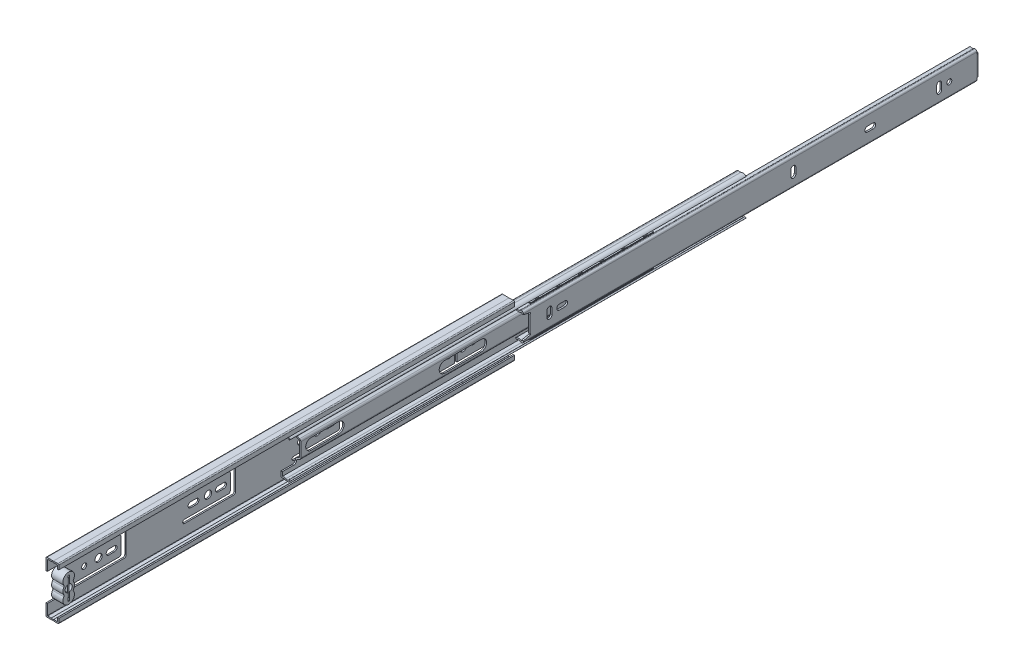
from build123d import *

# Parameters (mm, degrees)
BOSS_EXTRUDE1_START      = 6.35
BOSS_EXTRUDE1_DEPTH      = 400.05
BOSS_EXTRUDE2_DEPTH      = 203.2
BOSS_EXTRUDE2_DEPTH_BACK = 196.85
BOSS_EXTRUDE3_DEPTH      = 400.05
SKETCH8_W                = 1.905
SKETCH8_H                = 3.25755
CUT_EXTRUDE1_DEPTH       = 408.238333333
SKETCH9_W                = 1.397
SKETCH9_H                = 17.78
BOSS_EXTRUDE4_DEPTH      = 5.36016
FILLET1_R                = 1.651
FILLET2_R                = 0.254
SKETCH10_R               = 2.286
SKETCH10_R_2             = 3.175
CUT_EXTRUDE3_DEPTH       = 408.238333333
CUT_EXTRUDE5_DEPTH       = 408.114735613
CUT_EXTRUDE6_DEPTH       = 408.238333333
CUT_EXTRUDE6_DEPTH_BACK  = 408.238333333
SKETCH12_R               = 2.1844
SKETCH13_W               = 1.1938
SKETCH13_H               = 14.986
BOSS_EXTRUDE5_DEPTH      = 9.398
FILLET3_R                = 1.524
FILLET4_R                = 0.254
BOSS_EXTRUDE6_DEPTH      = 9.906
FILLET5_R                = 1.524
BOSS_EXTRUDE7_DEPTH      = 0.381
BOSS_EXTRUDE7_DEPTH_BACK = 0.381
SKETCH15_W               = 7.62
SKETCH15_H               = 107.95
LPATTERN1_COUNT          = 6
LPATTERN1_PITCH          = 19.05
BOSS_EXTRUDE8_DEPTH      = 0.381
BOSS_EXTRUDE8_DEPTH_BACK = 0.381
SKETCH17_W               = 5.08
SKETCH17_H               = 107.95
LPATTERN2_COUNT          = 6
LPATTERN2_PITCH          = 19.05


with BuildPart() as part:
    # Sketch5 → Boss-Extrude1 (new body)
    with BuildSketch(Plane.XY.offset(BOSS_EXTRUDE1_START)):
        with BuildLine():
            Line((4.9276, 18.415), (3.7338, 18.415))
            Line((3.7338, 18.415), (3.7338, 21.351668876))
            ThreePointArc((3.7338, 21.351668876), (3.656156384, 21.534465008), (3.470694285, 21.605505607))
            Line((3.470694285, 21.605505607), (0.424077102, 21.496216345))
            ThreePointArc((0.424077102, 21.496216345), (-0.671736167, 21.758871638), (-1.775065006, 21.529830168))
            Line((-1.775065006, 21.529830168), (-4.895551055, 21.611542971))
            ThreePointArc((-4.895551055, 21.611542971), (-5.079438777, 21.539570704), (-5.1562, 21.357630011))
            Line((-5.1562, 21.357630011), (-5.1562, -21.357630011))
            ThreePointArc((-5.1562, -21.357630011), (-5.079438777, -21.539570704), (-4.895551055, -21.611542971))
            Line((-4.895551055, -21.611542971), (-1.775065006, -21.529830168))
            ThreePointArc((-1.775065006, -21.529830168), (-0.671736167, -21.758871638), (0.424077102, -21.496216345))
            Line((0.424077102, -21.496216345), (3.470694285, -21.605505607))
            ThreePointArc((3.470694285, -21.605505607), (3.656156384, -21.534465008), (3.7338, -21.351668876))
            Line((3.7338, -21.351668876), (3.7338, -18.415))
            Line((3.7338, -18.415), (4.9276, -18.415))
            Line((4.9276, -18.415), (4.9276, -21.970365))
            ThreePointArc((4.9276, -21.970365), (4.667493886, -22.582732042), (4.046195853, -22.820718048))
            Line((4.046195853, -22.820718048), (0.032004, -22.676719627))
            Line((0.032004, -22.676719627), (-5.476826035, -22.820973418))
            ThreePointArc((-5.476826035, -22.820973418), (-6.092849902, -22.579866324), (-6.35, -21.970365))
            Line((-6.35, -21.970365), (-6.35, 21.970365))
            ThreePointArc((-6.35, 21.970365), (-6.092849902, 22.579866324), (-5.476826035, 22.820973418))
            Line((-5.476826035, 22.820973418), (0.032004, 22.676719627))
            Line((0.032004, 22.676719627), (4.046195853, 22.820718048))
            ThreePointArc((4.046195853, 22.820718048), (4.667493886, 22.582732042), (4.9276, 21.970365))
            Line((4.9276, 21.970365), (4.9276, 18.415))
        make_face()
    extrude(amount=BOSS_EXTRUDE1_DEPTH)

    # Sketch10 → Cut-Extrude3 (cut, through all)
    with BuildSketch(Plane(origin=(6.35, 0, 0), x_dir=(0, 0, -1), z_dir=(1, 0, 0))):
        with Locations(Location((-374.0912, 0, 0), (0, 0, 90))):
            Circle(SKETCH10_R)
        with Locations(Location((-53.9496, 0, 0), (0, 0, 90))):
            Circle(SKETCH10_R)
        with Locations(Location((-32.3596, 0, 0), (0, 0, 90))):
            Circle(SKETCH10_R)
        with Locations(Location((-41.3512, 0, 0), (0, 0, 90))):
            Circle(SKETCH10_R_2)
        with Locations(Location((-169.3672, 0, 0), (0, 0, 90))):
            Circle(SKETCH10_R_2)
        with Locations(Location((-265.3792, 0, 0), (0, 0, 90))):
            Circle(SKETCH10_R_2)
        with Locations(Location((-361.3912, 0, 0), (0, 0, 90))):
            Circle(SKETCH10_R_2)
        with Locations(Location((-387.35, 0, 0), (0, 0, 90))):
            Circle(SKETCH10_R_2)
        with BuildLine():
            Line((-155.4607, 2.286), (-160.4137, 2.286))
            ThreePointArc((-160.4137, 2.286), (-162.6997, 0), (-160.4137, -2.286))
            Line((-160.4137, -2.286), (-155.4607, -2.286))
            ThreePointArc((-155.4607, -2.286), (-153.1747, 0), (-155.4607, 2.286))
        make_face()
        with BuildLine():
            Line((-179.5907, 2.286), (-184.5437, 2.286))
            ThreePointArc((-184.5437, 2.286), (-186.8297, 0), (-184.5437, -2.286))
            Line((-184.5437, -2.286), (-179.5907, -2.286))
            ThreePointArc((-179.5907, -2.286), (-177.3047, 0), (-179.5907, 2.286))
        make_face()
        with BuildLine():
            Line((-145.2372, -10.033), (-145.2372, 10.033))
            ThreePointArc((-145.2372, 10.033), (-145.683569265, 11.110630735), (-146.7612, 11.557))
            Line((-146.7612, 11.557), (-190.0174, 11.557))
            ThreePointArc((-190.0174, 11.557), (-191.6049, 9.9695), (-190.0174, 8.382))
            Line((-190.0174, 8.382), (-151.3332, 8.382))
            ThreePointArc((-151.3332, 8.382), (-150.255569265, 7.935630735), (-149.8092, 6.858))
            Line((-149.8092, 6.858), (-149.8092, -6.858))
            ThreePointArc((-149.8092, -6.858), (-150.255569265, -7.935630735), (-151.3332, -8.382))
            Line((-151.3332, -8.382), (-190.0174, -8.382))
            ThreePointArc((-190.0174, -8.382), (-191.6049, -9.9695), (-190.0174, -11.557))
            Line((-190.0174, -11.557), (-146.7612, -11.557))
            ThreePointArc((-146.7612, -11.557), (-145.683569265, -11.110630735), (-145.2372, -10.033))
        make_face()
        with BuildLine():
            Line((-256.4257, 2.286), (-251.4727, 2.286))
            ThreePointArc((-251.4727, 2.286), (-249.1867, 0), (-251.4727, -2.286))
            Line((-251.4727, -2.286), (-256.4257, -2.286))
            ThreePointArc((-256.4257, -2.286), (-258.7117, 0), (-256.4257, 2.286))
        make_face()
        with BuildLine():
            Line((-352.4377, 2.286), (-347.4847, 2.286))
            ThreePointArc((-347.4847, 2.286), (-345.1987, 0), (-347.4847, -2.286))
            Line((-347.4847, -2.286), (-352.4377, -2.286))
            ThreePointArc((-352.4377, -2.286), (-354.7237, 0), (-352.4377, 2.286))
        make_face()
        with BuildLine():
            Line((-280.5557, -2.286), (-275.6027, -2.286))
            ThreePointArc((-275.6027, -2.286), (-273.3167, 0), (-275.6027, 2.286))
            Line((-275.6027, 2.286), (-280.5557, 2.286))
            ThreePointArc((-280.5557, 2.286), (-282.8417, 0), (-280.5557, -2.286))
        make_face()
        with BuildLine():
            Line((-69.1261, 2.286), (-64.1731, 2.286))
            ThreePointArc((-64.1731, 2.286), (-61.8871, 0), (-64.1731, -2.286))
            Line((-64.1731, -2.286), (-69.1261, -2.286))
            ThreePointArc((-69.1261, -2.286), (-71.4121, 0), (-69.1261, 2.286))
        make_face()
        with BuildLine():
            Line((-286.0294, -8.382), (-247.3452, -8.382))
            ThreePointArc((-247.3452, -8.382), (-246.267569265, -7.935630735), (-245.8212, -6.858))
            Line((-245.8212, -6.858), (-245.8212, 6.858))
            ThreePointArc((-245.8212, 6.858), (-246.267569265, 7.935630735), (-247.3452, 8.382))
            Line((-247.3452, 8.382), (-286.0294, 8.382))
            ThreePointArc((-286.0294, 8.382), (-287.6169, 9.9695), (-286.0294, 11.557))
            Line((-286.0294, 11.557), (-242.7732, 11.557))
            ThreePointArc((-242.7732, 11.557), (-241.695569265, 11.110630735), (-241.2492, 10.033))
            Line((-241.2492, 10.033), (-241.2492, -10.033))
            ThreePointArc((-241.2492, -10.033), (-241.695569265, -11.110630735), (-242.7732, -11.557))
            Line((-242.7732, -11.557), (-286.0294, -11.557))
            ThreePointArc((-286.0294, -11.557), (-287.6169, -9.9695), (-286.0294, -8.382))
        make_face()
        with BuildLine():
            Line((-382.0414, -8.382), (-343.3572, -8.382))
            ThreePointArc((-343.3572, -8.382), (-342.279569265, -7.935630735), (-341.8332, -6.858))
            Line((-341.8332, -6.858), (-341.8332, 6.858))
            ThreePointArc((-341.8332, 6.858), (-342.279569265, 7.935630735), (-343.3572, 8.382))
            Line((-343.3572, 8.382), (-382.0414, 8.382))
            ThreePointArc((-382.0414, 8.382), (-383.6289, 9.9695), (-382.0414, 11.557))
            Line((-382.0414, 11.557), (-338.7852, 11.557))
            ThreePointArc((-338.7852, 11.557), (-337.707569265, 11.110630735), (-337.2612, 10.033))
            Line((-337.2612, 10.033), (-337.2612, -10.033))
            ThreePointArc((-337.2612, -10.033), (-337.707569265, -11.110630735), (-338.7852, -11.557))
            Line((-338.7852, -11.557), (-382.0414, -11.557))
            ThreePointArc((-382.0414, -11.557), (-383.6289, -9.9695), (-382.0414, -8.382))
        make_face()
        with BuildLine():
            Line((-74.7268, 11.557), (-23.7998, 11.557))
            ThreePointArc((-23.7998, 11.557), (-22.2123, 9.9695), (-23.7998, 8.382))
            Line((-23.7998, 8.382), (-46.863, 8.382))
            Line((-46.863, 8.382), (-46.863, -8.382))
            Line((-46.863, -8.382), (-23.7998, -8.382))
            ThreePointArc((-23.7998, -8.382), (-22.2123, -9.9695), (-23.7998, -11.557))
            Line((-23.7998, -11.557), (-74.7268, -11.557))
            ThreePointArc((-74.7268, -11.557), (-76.3143, -9.9695), (-74.7268, -8.382))
            Line((-74.7268, -8.382), (-49.149, -8.382))
            Line((-49.149, -8.382), (-49.149, 8.382))
            Line((-49.149, 8.382), (-74.7268, 8.382))
            ThreePointArc((-74.7268, 8.382), (-76.3143, 9.9695), (-74.7268, 11.557))
        make_face()
        with BuildLine():
            Line((-398.1958, 7.493), (-398.1958, -7.493))
            Line((-398.1958, -7.493), (-396.740759713, -7.660376109))
            ThreePointArc((-396.740759713, -7.660376109), (-394.719747098, -10.062234601), (-397.002, -12.2174))
            Line((-397.002, -12.2174), (-406.4, -12.2174))
            Line((-406.4, -12.2174), (-406.4, 12.2174))
            Line((-406.4, 12.2174), (-397.002, 12.2174))
            ThreePointArc((-397.002, 12.2174), (-394.719747098, 10.062234601), (-396.740759713, 7.660376109))
            Line((-396.740759713, 7.660376109), (-398.1958, 7.493))
        make_face()
    extrude(amount=-CUT_EXTRUDE3_DEPTH, mode=Mode.SUBTRACT)

    # Sketch13 → Boss-Extrude5 (add)
    with BuildSketch(Plane(origin=(-5.1562, 0, 0), x_dir=(0, 0, -1), z_dir=(1, 0, 0))):
        with Locations((-397.5989, 0)):
            Rectangle(SKETCH13_W, SKETCH13_H)
    extrude(amount=BOSS_EXTRUDE5_DEPTH)

    # Fillet3
    # the kernel refuses this fillet: 1.524 mm, written as the material it takes off along each edge
    with BuildSketch(Plane(origin=(-6.35, -11.303, 398.1958), x_dir=(0, 0, -1), z_dir=(0, 1, 0))) as fillet3_piece_1:
        with BuildLine():
            CenterArc((FILLET3_R, -FILLET3_R), FILLET3_R, 90, 90)
            Line((0, -FILLET3_R), (0, 0))
            Line((0, 0), (FILLET3_R, 0))
        make_face()
    extrude(amount=22.606, mode=Mode.SUBTRACT)

    # Fillet4
    fillet4_edges = [part.edges().sort_by_distance(p)[0] for p in [
        (-5.1562, 0, 397.002),
    ]]
    fillet(fillet4_edges, radius=FILLET4_R)


with BuildPart() as body_2:
    # Sketch6 → Boss-Extrude2 (new, two sides: drawn at the far end of the back side and taken through both)
    with BuildSketch(Plane.XY.offset(-BOSS_EXTRUDE2_DEPTH_BACK)):
        with BuildLine():
            Line((-2.118971253, -9.521740172), (-2.118971253, -15.673265724))
            ThreePointArc((-2.118971253, -15.673265724), (-0.543137328, -15.404768735), (1.002576062, -15.812338741))
            ThreePointArc((1.002576062, -15.812338741), (2.613411889, -15.998010642), (3.953597112, -15.08522935))
            Line((3.953597112, -15.08522935), (4.9276, -15.77550235))
            ThreePointArc((4.9276, -15.77550235), (2.899013625, -17.157143977), (0.46075393, -16.876099624))
            ThreePointArc((0.46075393, -16.876099624), (-0.583547375, -16.597984033), (-1.65020857, -16.771614073))
            ThreePointArc((-1.65020857, -16.771614073), (-2.781285168, -16.642612521), (-3.312771253, -15.635886038))
            Line((-3.312771253, -15.635886038), (-3.312771253, -9.521740172))
            ThreePointArc((-3.312771253, -9.521740172), (-3.002498386, -8.457242188), (-2.168862554, -7.726163184))
            Line((-2.168862554, -7.726163184), (-0.196736138, -6.806545534))
            ThreePointArc((-0.196736138, -6.806545534), (0.123893028, -6.525361302), (0.243228747, -6.115939))
            Line((0.243228747, -6.115939), (0.243228747, 6.115939))
            ThreePointArc((0.243228747, 6.115939), (0.123893028, 6.525361302), (-0.196736138, 6.806545534))
            Line((-0.196736138, 6.806545534), (-2.168862554, 7.726163184))
            ThreePointArc((-2.168862554, 7.726163184), (-3.002498386, 8.457242188), (-3.312771253, 9.521740172))
            Line((-3.312771253, 9.521740172), (-3.312771253, 15.635886038))
            ThreePointArc((-3.312771253, 15.635886038), (-2.781285168, 16.642612521), (-1.65020857, 16.771614073))
            ThreePointArc((-1.65020857, 16.771614073), (-0.583547375, 16.597984033), (0.46075393, 16.876099624))
            ThreePointArc((0.46075393, 16.876099624), (2.899013625, 17.157143977), (4.9276, 15.77550235))
            Line((4.9276, 15.77550235), (3.953597112, 15.08522935))
            ThreePointArc((3.953597112, 15.08522935), (2.613411889, 15.998010642), (1.002576062, 15.812338741))
            ThreePointArc((1.002576062, 15.812338741), (-0.543137328, 15.404768735), (-2.118971253, 15.673265724))
            Line((-2.118971253, 15.673265724), (-2.118971253, 9.521740172))
            ThreePointArc((-2.118971253, 9.521740172), (-1.995657678, 9.09867046), (-1.664340873, 8.80811342))
            Line((-1.664340873, 8.80811342), (0.307785543, 7.88849577))
            ThreePointArc((0.307785543, 7.88849577), (1.130733736, 7.166789574), (1.437028747, 6.115939))
            Line((1.437028747, 6.115939), (1.437028747, -6.115939))
            ThreePointArc((1.437028747, -6.115939), (1.130733736, -7.166789574), (0.307785543, -7.88849577))
            Line((0.307785543, -7.88849577), (-1.664340873, -8.80811342))
            ThreePointArc((-1.664340873, -8.80811342), (-1.995657678, -9.09867046), (-2.118971253, -9.521740172))
        make_face()
    extrude(amount=BOSS_EXTRUDE2_DEPTH + BOSS_EXTRUDE2_DEPTH_BACK)

    # Sketch11 → Cut-Extrude5 (cut, through all)
    with BuildSketch(Plane(origin=(1.437028747, 0, 0), x_dir=(0, 0, -1), z_dir=(1, 0, 0))):
        with BuildLine():
            Line((-203.2, 12.065), (-203.2, -12.065))
            Line((-203.2, -12.065), (-193.04, -12.065))
            ThreePointArc((-193.04, -12.065), (-191.243948776, -11.321051224), (-190.5, -9.525))
            Line((-190.5, -9.525), (-190.5, 9.525))
            ThreePointArc((-190.5, 9.525), (-191.243948776, 11.321051224), (-193.04, 12.065))
            Line((-193.04, 12.065), (-203.2, 12.065))
        make_face()
        with BuildLine():
            Line((-32.2326, 4.826), (-64.1731, 4.826))
            ThreePointArc((-64.1731, 4.826), (-68.9991, 0), (-64.1731, -4.826))
            Line((-64.1731, -4.826), (-32.2326, -4.826))
            ThreePointArc((-32.2326, -4.826), (-27.4066, 0), (-32.2326, 4.826))
        make_face()
        with BuildLine():
            Line((-157.3657, 4.826), (-181.3687, 4.826))
            ThreePointArc((-181.3687, 4.826), (-186.1947, 0), (-181.3687, -4.826))
            Line((-181.3687, -4.826), (-157.3657, -4.826))
            ThreePointArc((-157.3657, -4.826), (-152.5397, 0), (-157.3657, 4.826))
        make_face()
    extrude(amount=-CUT_EXTRUDE5_DEPTH, mode=Mode.SUBTRACT)


with BuildPart() as body_3:
    # Sketch7 → Boss-Extrude3 (new body)
    with BuildSketch(Plane.XY):
        with BuildLine():
            Line((0.518100184, 12.000136985), (-0.407162, 10.953476156))
            ThreePointArc((-0.407162, 10.953476156), (1.785052967, 10.030279913), (4.088556466, 10.62355))
            Line((4.088556466, 10.62355), (4.953, 10.62355))
            Line((4.953, 10.62355), (4.953, -10.62355))
            ThreePointArc((4.953, -10.62355), (4.915802561, -10.713352561), (4.826, -10.75055))
            Line((4.826, -10.75055), (4.271310903, -10.75055))
            ThreePointArc((4.271310903, -10.75055), (1.896150971, -10.0237954), (-0.407162, -10.953476156))
            Line((-0.407162, -10.953476156), (0.518100184, -12.000136985))
            ThreePointArc((0.518100184, -12.000136985), (1.943956939, -11.42007032), (3.419579752, -11.858342079))
            ThreePointArc((3.419579752, -11.858342079), (3.84336969, -12.073446398), (4.312812376, -12.14755))
            Line((4.312812376, -12.14755), (4.826, -12.14755))
            ThreePointArc((4.826, -12.14755), (5.903630735, -11.701180735), (6.35, -10.62355))
            Line((6.35, -10.62355), (6.35, 10.62355))
            ThreePointArc((6.35, 10.62355), (5.903630735, 11.701180735), (4.826, 12.14755))
            Line((4.826, 12.14755), (4.312812376, 12.14755))
            ThreePointArc((4.312812376, 12.14755), (3.84336969, 12.073446398), (3.419579752, 11.858342079))
            ThreePointArc((3.419579752, 11.858342079), (1.943956939, 11.42007032), (0.518100184, 12.000136985))
        make_face()
    extrude(amount=-BOSS_EXTRUDE3_DEPTH)

    # Sketch8 → Cut-Extrude1 (cut, through all)
    with BuildSketch(Plane(origin=(6.35, 0, 0), x_dir=(0, 0, -1), z_dir=(1, 0, 0))):
        with Locations((399.0975, 10.518775)):
            Rectangle(SKETCH8_W, SKETCH8_H)
        with Locations((399.0975, -10.518775)):
            Rectangle(SKETCH8_W, SKETCH8_H)
    extrude(amount=-CUT_EXTRUDE1_DEPTH, mode=Mode.SUBTRACT)

    # Sketch9 → Boss-Extrude4 (add)
    with BuildSketch(Plane.ZY.offset(-4.953)):
        with Locations((-399.3515, 0)):
            Rectangle(SKETCH9_W, SKETCH9_H)
    extrude(amount=BOSS_EXTRUDE4_DEPTH)

    # Fillet1
    fillet1_edges = [body_3.edges().sort_by_distance(p)[0] for p in [
        (6.35, 0, -400.05),
    ]]
    fillet(fillet1_edges, radius=FILLET1_R)

    # Fillet2
    fillet2_edges = [body_3.edges().sort_by_distance(p)[0] for p in [
        (4.953, 0, -398.653),
    ]]
    fillet(fillet2_edges, radius=FILLET2_R)

    # Sketch12 → Cut-Extrude6 (cut, two sides: drawn at the far end of the back side and taken through both)
    with BuildSketch(Plane(origin=(6.35, 0, 0), x_dir=(0, 0, -1), z_dir=(1, 0, 0)).offset(-CUT_EXTRUDE6_DEPTH_BACK)):
        with Locations(Location((373.888, 0, 0), (0, 0, 90))):
            Circle(SKETCH12_R)
        with BuildLine():
            Line((5.715, 7.331475009), (5.715, -7.331475009))
            ThreePointArc((5.715, -7.331475009), (6.345918128, -7.894590968), (5.85784392, -8.5852))
            Line((5.85784392, -8.5852), (0, -9.93758983))
            Line((0, -9.93758983), (0, 9.93758983))
            Line((0, 9.93758983), (5.85784392, 8.5852))
            ThreePointArc((5.85784392, 8.5852), (6.345918128, 7.894590968), (5.715, 7.331475009))
        make_face()
        with BuildLine():
            Line((367.1824, -2.6416), (367.1824, 2.6416))
            ThreePointArc((367.1824, 2.6416), (364.998, 4.826), (362.8136, 2.6416))
            Line((362.8136, 2.6416), (362.8136, -2.6416))
            ThreePointArc((362.8136, -2.6416), (364.998, -4.826), (367.1824, -2.6416))
        make_face()
        with BuildLine():
            Line((302.0695, -2.286), (307.0225, -2.286))
            ThreePointArc((307.0225, -2.286), (309.3085, 0), (307.0225, 2.286))
            Line((307.0225, 2.286), (302.0695, 2.286))
            ThreePointArc((302.0695, 2.286), (299.7835, 0), (302.0695, -2.286))
        make_face()
        with BuildLine():
            Line((239.1664, -2.6416), (239.1664, 2.6416))
            ThreePointArc((239.1664, 2.6416), (236.982, 4.826), (234.7976, 2.6416))
            Line((234.7976, 2.6416), (234.7976, -2.6416))
            ThreePointArc((234.7976, -2.6416), (236.982, -4.826), (239.1664, -2.6416))
        make_face()
        with BuildLine():
            Line((31.5595, 2.286), (36.5125, 2.286))
            ThreePointArc((36.5125, 2.286), (38.7985, 0), (36.5125, -2.286))
            Line((36.5125, -2.286), (31.5595, -2.286))
            ThreePointArc((31.5595, -2.286), (29.2735, 0), (31.5595, 2.286))
        make_face()
        with BuildLine():
            Line((20.6756, -2.6416), (20.6756, 2.6416))
            ThreePointArc((20.6756, 2.6416), (22.86, 4.826), (25.0444, 2.6416))
            Line((25.0444, 2.6416), (25.0444, -2.6416))
            ThreePointArc((25.0444, -2.6416), (22.86, -4.826), (20.6756, -2.6416))
        make_face()
    extrude(amount=CUT_EXTRUDE6_DEPTH + CUT_EXTRUDE6_DEPTH_BACK, mode=Mode.SUBTRACT)


with BuildPart() as body_4:
    # Sketch14 → Boss-Extrude6 (new body)
    with BuildSketch(Plane(origin=(-5.1562, 0, 0), x_dir=(0, 0, -1), z_dir=(1, 0, 0))):
        with BuildLine():
            ThreePointArc((-394.021555488, -3.6068), (-392.5189, 0), (-394.021555488, 3.6068))
            ThreePointArc((-394.021555488, 3.6068), (-397.5989, 12.2936), (-401.176244512, 3.6068))
            ThreePointArc((-401.176244512, 3.6068), (-402.6789, 0), (-401.176244512, -3.6068))
            ThreePointArc((-401.176244512, -3.6068), (-397.5989, -12.2936), (-394.021555488, -3.6068))
        make_face()
        with BuildLine():
            Line((-396.9004, -3.097212093), (-396.9004, -9.8552))
            Line((-396.9004, -9.8552), (-398.2974, -9.8552))
            Line((-398.2974, -9.8552), (-398.2974, -3.097212093))
            ThreePointArc((-398.2974, -3.097212093), (-400.7739, 0), (-398.2974, 3.097212093))
            Line((-398.2974, 3.097212093), (-398.2974, 9.8552))
            Line((-398.2974, 9.8552), (-396.9004, 9.8552))
            Line((-396.9004, 9.8552), (-396.9004, 3.097212093))
            ThreePointArc((-396.9004, 3.097212093), (-394.4239, 0), (-396.9004, -3.097212093))
        make_face(mode=Mode.SUBTRACT)
    extrude(amount=BOSS_EXTRUDE6_DEPTH)

    # Fillet5
    fillet5_edges = [body_4.edges().sort_by_distance(p)[0] for p in [
        (-0.2032, -3.6068, 401.176244512),
        (-0.2032, 3.6068, 401.176244512),
        (-0.2032, 3.6068, 394.021555488),
        (-0.2032, -3.6068, 394.021555488),
    ]]
    fillet(fillet5_edges, radius=FILLET5_R)


with BuildPart() as body_5:
    # Sketch15 → Boss-Extrude7 (new, two sides: drawn at the far end of the back side and taken through both)
    with BuildSketch(Plane(origin=(0, -19.177, 0), x_dir=(1, 0, 0), z_dir=(0, 1, 0)).offset(-BOSS_EXTRUDE7_DEPTH_BACK)):
        with Locations((-0.7112, -66.675)):
            Rectangle(SKETCH15_W, SKETCH15_H)
    extrude(amount=BOSS_EXTRUDE7_DEPTH + BOSS_EXTRUDE7_DEPTH_BACK)

    # Sketch16 → Revolve1 (revolve)
    with BuildSketch(Plane(origin=(0, -19.177, 0), x_dir=(1, 0, 0), z_dir=(0, 1, 0))):
        with BuildLine():
            Line((-0.7112, -111.76), (-0.7112, -116.84))
            ThreePointArc((-0.7112, -116.84), (1.8288, -114.3), (-0.7112, -111.76))
        make_face()
    revolve1 = revolve(axis=Axis((-0.7112, -19.177, 111.76), (0, 0, 1)))

    # LPattern1: Revolve1 ×6
    with Locations(*[(0, 0, -i * LPATTERN1_PITCH) for i in range(1, LPATTERN1_COUNT)]):
        add(revolve1)


with BuildPart() as body_6:
    # Sketch17 → Boss-Extrude8 (new, two sides: drawn at the far end of the back side and taken through both)
    with BuildSketch(Plane(origin=(0, -13.7414, 0), x_dir=(1, 0, 0), z_dir=(0, 1, 0)).offset(-BOSS_EXTRUDE8_DEPTH_BACK)):
        with Locations((2.0574, 61.9125)):
            Rectangle(SKETCH17_W, SKETCH17_H)
    extrude(amount=BOSS_EXTRUDE8_DEPTH + BOSS_EXTRUDE8_DEPTH_BACK)

    # Sketch19 → Revolve2 (revolve)
    with BuildSketch(Plane(origin=(0, -13.7414, 0), x_dir=(1, 0, 0), z_dir=(0, 1, 0))):
        with BuildLine():
            Line((2.0574, 11.9888), (2.0574, 16.5862))
            ThreePointArc((2.0574, 16.5862), (4.3561, 14.2875), (2.0574, 11.9888))
        make_face()
    revolve2 = revolve(axis=Axis((2.0574, -13.7414, -14.2875), (0, 0, 1)))

    # LPattern2: Revolve2 ×6
    with Locations(*[(0, 0, -i * LPATTERN2_PITCH) for i in range(1, LPATTERN2_COUNT)]):
        add(revolve2)


with BuildPart() as body_7:
    # Mirror1: mirrored copy
    add(body_5.part.mirror(Plane.ZX))


with BuildPart() as body_8:
    # Mirror1 2: mirrored copy
    add(body_6.part.mirror(Plane.ZX))


solid = Compound([part.part, body_2.part, body_3.part, body_4.part, body_5.part, body_6.part, body_7.part, body_8.part])
